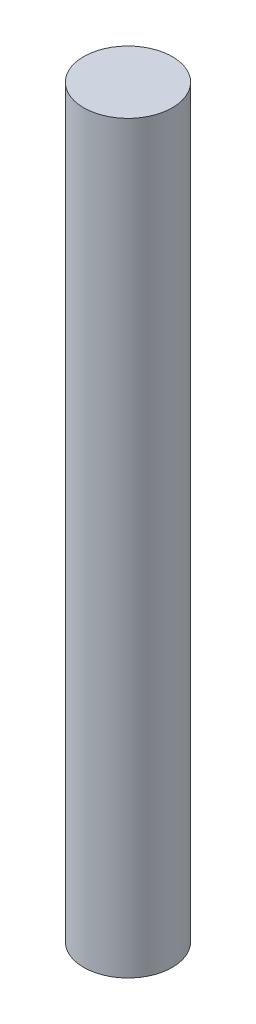
from build123d import *

# Parameters (mm, degrees)
SKETCH1_R           = 2.38125
BOSS_EXTRUDE1_DEPTH = 39.999999978


with BuildPart() as part:
    # Sketch1 → Boss-Extrude1 (new body)
    with BuildSketch(Plane(origin=(0, 0, 0), x_dir=(1, 0, 0), z_dir=(0, 1, 0))):
        Circle(SKETCH1_R)
    extrude(amount=BOSS_EXTRUDE1_DEPTH)


solid = part.part
